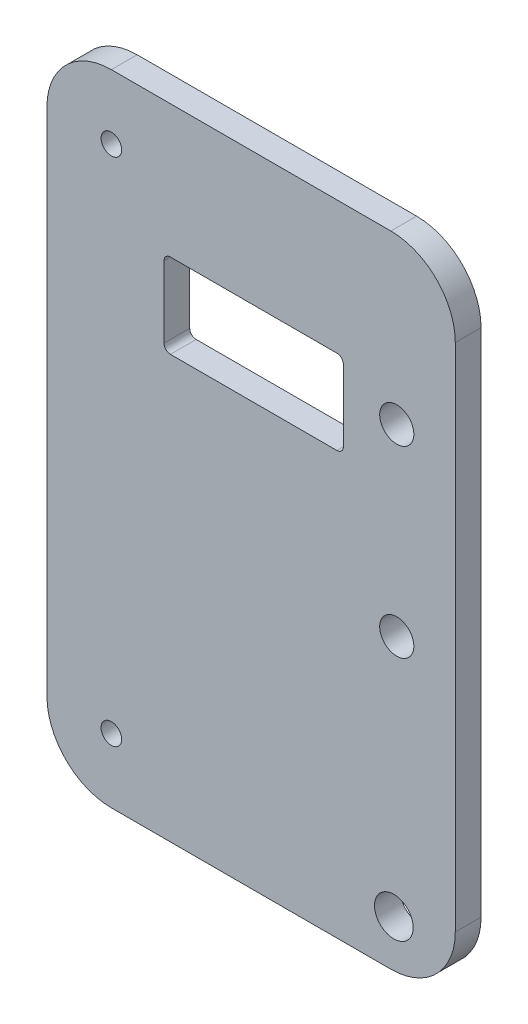
from build123d import *

# Parameters (mm, degrees)
SKETCH1_W            = 63.384201813
SKETCH1_H            = 99.23964582
BOSS_EXTRUDE1_DEPTH  = 4
M5_CLEARANCE_HOLE1_D = 5.3
FILLET1_R            = 10
M5_CLEARANCE_HOLE2_D = 6
M3_CLEARANCE_HOLE1_D = 3.2


with BuildPart() as part:
    # Sketch1 → Boss-Extrude1 (new body)
    with BuildSketch(Plane.XY):
        with Locations((-76.771477461, -317.489186132)):
            Rectangle(SKETCH1_W, SKETCH1_H)
        with BuildLine():
            Line((-63.453357461, -301.557900971), (-89.297127128, -301.557900971))
            ThreePointArc((-89.297127128, -301.557900971), (-90.004233909, -301.265007752), (-90.297127128, -300.557900971))
            Line((-90.297127128, -300.557900971), (-90.297127128, -289.479666407))
            ThreePointArc((-90.297127128, -289.479666407), (-90.004233909, -288.772559625), (-89.297127128, -288.479666407))
            Line((-89.297127128, -288.479666407), (-63.453357461, -288.479666407))
            ThreePointArc((-63.453357461, -288.479666407), (-62.74625068, -288.772559625), (-62.453357461, -289.479666407))
            Line((-62.453357461, -289.479666407), (-62.453357461, -300.557900971))
            ThreePointArc((-62.453357461, -300.557900971), (-62.74625068, -301.265007752), (-63.453357461, -301.557900971))
        make_face(mode=Mode.SUBTRACT)
    extrude(amount=BOSS_EXTRUDE1_DEPTH)

    # M5 Clearance Hole1 (through all)
    with Locations(Plane.XY.offset(4)):
        with Locations((-54.16270611, -321.915681156), (-54.16270611, -293.415681156)):
            Hole(M5_CLEARANCE_HOLE1_D / 2)

    # Fillet1
    fillet1_edges = [part.edges().sort_by_distance(p)[0] for p in [
        (-108.463578367, -267.869363222, 2),
        (-45.079376554, -267.869363222, 2),
        (-108.463578367, -367.109009042, 2),
        (-45.079376554, -367.109009042, 2),
    ]]
    fillet(fillet1_edges, radius=FILLET1_R)

    # M5 Clearance Hole2 (through all)
    with Locations(Plane(origin=(0, 0, 0), x_dir=(-1, 0, 0), z_dir=(0, 0, -1))):
        with Locations((54.617319332, -359.802896905)):
            Hole(M5_CLEARANCE_HOLE2_D / 2)

    # M3 Clearance Hole1 (through all)
    with Locations(Plane.XY.offset(4)):
        with Locations((-98.463578367, -357.109009042), (-98.463578367, -277.869363222)):
            Hole(M3_CLEARANCE_HOLE1_D / 2)


solid = part.part
